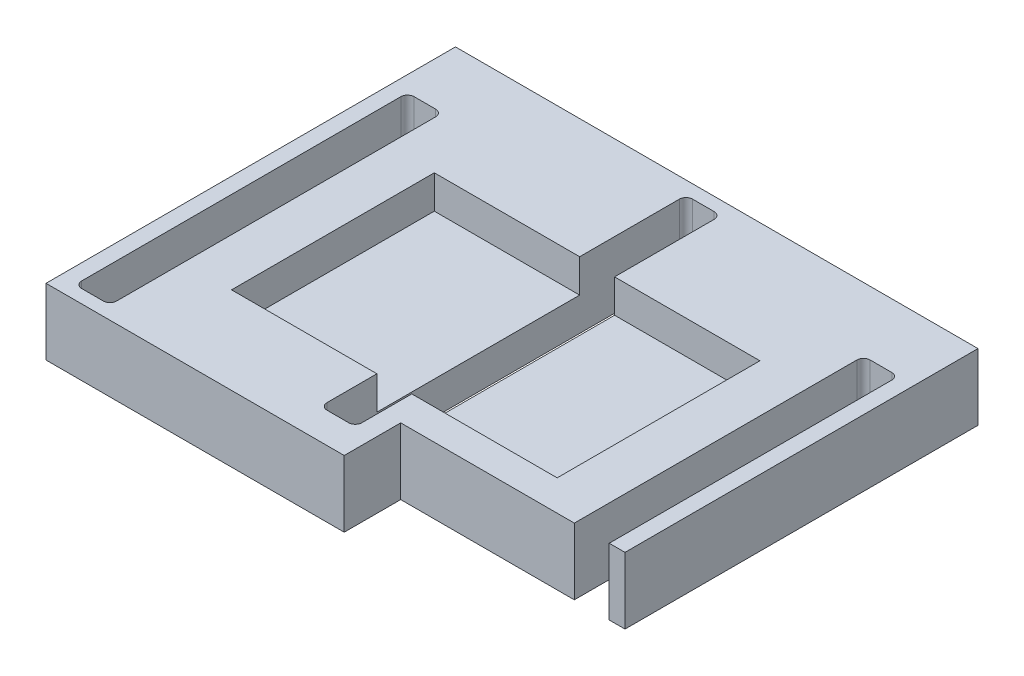
from build123d import *

# Parameters (mm, degrees)
BOSS_EXTRUDE1_DEPTH = 10
FILLET1_R           = 1
SKETCH2_W           = 21.86553483
SKETCH2_H           = 30.5
CUT_EXTRUDE1_DEPTH  = 5
MIRROR1_DEPTH       = 10
MIRROR1_2_OUTLINE_W = 21.86553483
MIRROR1_2_OUTLINE_H = 30.5
MIRROR1_2_DEPTH     = 5
SKETCH6_W           = 43.680332617
SKETCH6_H           = 16.249834628
CUT_EXTRUDE2_DEPTH  = 10


# Read off the part's stored shape, not the designer's step: Mirror1
with BuildPart() as part:
    # Sketch1 → Boss-Extrude1 (new body)
    with BuildSketch(Plane(origin=(0, 0, 0), x_dir=(1, 0, 0), z_dir=(0, 1, 0))):
        Polygon((-5, 57.097150921), (34.3, 57.097150921), (34.3, 55.097150921), (31.675, 55.097150921), (31.675, 52.597150921), (31.675, 2.599340873), (31.675, 0.099340873), (34.3, 0.099340873), (34.3, -4.5), (-5, -4.5), align=None)
        Polygon((-2.625, 45), (-2.625, 0), (-2.625, -2.5), (0, -2.5), (2.625, -2.5), (2.625, 0), (2.625, 45), (2.625, 47.5), (0, 47.5), (-2.625, 47.5), align=None, mode=Mode.SUBTRACT)
    extrude(amount=BOSS_EXTRUDE1_DEPTH)

    # Fillet1
    fillet1_edges = [part.edges().sort_by_distance(p)[0] for p in [
        (31.675, 5, -55.097150921),
        (31.675, 5, -0.099340873),
        (-2.625, 5, -47.5),
        (-2.625, 5, 2.5),
        (2.625, 5, 2.5),
        (2.625, 5, -47.5),
    ]]
    fillet(fillet1_edges, radius=FILLET1_R)

    # Sketch2 → Cut-Extrude1 (cut)
    with BuildSketch(Plane(origin=(0, 10, 0), x_dir=(1, 0, 0), z_dir=(0, 1, 0))):
        with Locations((20.742232585, 23.8519351)):
            Rectangle(SKETCH2_W, SKETCH2_H)
    extrude(amount=-CUT_EXTRUDE1_DEPTH, mode=Mode.SUBTRACT)

    # Mirror1 outline → Mirror1 (add)
    with BuildSketch(Plane(origin=(0, 0, 0), x_dir=(1, 0, 0), z_dir=(0, 1, 0))):
        with BuildLine():
            ThreePointArc((35.925, 55.097150921), (36.632106781, 54.804257702), (36.925, 54.097150921))
            Line((36.925, 54.097150921), (36.925, 39.1019351))
            Line((36.925, 39.1019351), (58.79053483, 39.1019351))
            Line((58.79053483, 39.1019351), (58.79053483, 8.6019351))
            Line((58.79053483, 8.6019351), (36.925, 8.6019351))
            Line((36.925, 8.6019351), (36.925, 1.099340873))
            ThreePointArc((36.925, 1.099340873), (36.632106781, 0.392234092), (35.925, 0.099340873))
            Line((35.925, 0.099340873), (34.3, 0.099340873))
            Line((34.3, 0.099340873), (34.3, -4.5))
            Line((34.3, -4.5), (73.6, -4.5))
            Line((73.6, -4.5), (73.6, 57.097150921))
            Line((73.6, 57.097150921), (34.3, 57.097150921))
            Line((34.3, 57.097150921), (34.3, 55.097150921))
            Line((34.3, 55.097150921), (35.925, 55.097150921))
        make_face()
        with BuildLine():
            Line((70.225, -2.5), (66.975, -2.5))
            ThreePointArc((66.975, -2.5), (66.267893219, -2.207106781), (65.975, -1.5))
            Line((65.975, -1.5), (65.975, 46.5))
            ThreePointArc((65.975, 46.5), (66.267893219, 47.207106781), (66.975, 47.5))
            Line((66.975, 47.5), (70.225, 47.5))
            ThreePointArc((70.225, 47.5), (70.932106781, 47.207106781), (71.225, 46.5))
            Line((71.225, 46.5), (71.225, -1.5))
            ThreePointArc((71.225, -1.5), (70.932106781, -2.207106781), (70.225, -2.5))
        make_face(mode=Mode.SUBTRACT)
    extrude(amount=MIRROR1_DEPTH)

    # Mirror1 2 outline → Mirror1 2 (add)
    with BuildSketch(Plane(origin=(0, 0, 0), x_dir=(1, 0, 0), z_dir=(0, 1, 0))):
        with Locations((47.857767415, 23.8519351)):
            Rectangle(MIRROR1_2_OUTLINE_W, MIRROR1_2_OUTLINE_H)
    extrude(amount=MIRROR1_2_DEPTH)

    # Sketch6 → Cut-Extrude2 (cut)
    with BuildSketch(Plane(origin=(0, 10, 0), x_dir=(1, 0, 0), z_dir=(0, 1, 0))):
        with Locations((61.699631479, -4.127511542)):
            Rectangle(SKETCH6_W, SKETCH6_H)
    extrude(amount=-CUT_EXTRUDE2_DEPTH, mode=Mode.SUBTRACT)


solid = part.part
